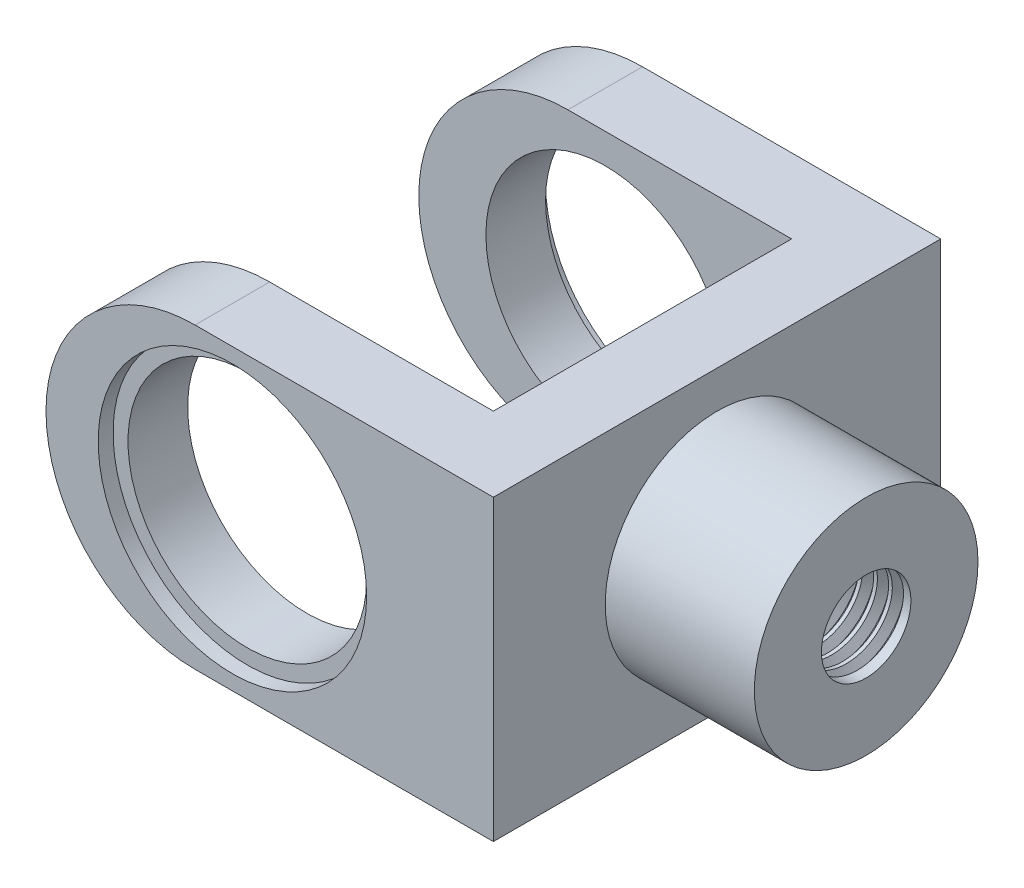
from build123d import *
from build123d.topology import SkipClean

# Parameters (mm, degrees)
IZIM1_R                     = 4
Y_KSEKLIK_EKSTR_ZYON1_DEPTH = 30
IZIM2_W                     = 20
IZIM2_H                     = 20
KES_EKSTR_ZYON1_DEPTH       = 51
IZIM3_W                     = 30
IZIM3_H                     = 20
Y_KSEKLIK_EKSTR_ZYON2_DEPTH = 5
IZIM4_R                     = 7.5
Y_KSEKLIK_EKSTR_ZYON3_DEPTH = 10
IZIM7_R                     = 3
KES_EKSTR_ZYON2_DEPTH       = 10
SKETCH1_R                   = 8
CUT_EXTRUDE1_DEPTH          = 33
SKETCH2_R                   = 9
CUT_EXTRUDE2_DEPTH          = 1
SKETCH3_R                   = 9
CUT_EXTRUDE3_DEPTH          = 1
THREAD1_PITCH               = 1


with BuildPart() as part:
    # Çizim1 → Yükseklik-Ekstrüzyon1 (new body)
    with BuildSketch(Plane.XY):
        with BuildLine():
            Line((0, 10), (20, 10))
            Line((20, 10), (20, -10))
            Line((20, -10), (0, -10))
            ThreePointArc((0, -10), (-10, 0), (0, 10))
        make_face()
        with Locations((2.5, 0)):
            Circle(IZIM1_R, mode=Mode.SUBTRACT)
    extrude(amount=Y_KSEKLIK_EKSTR_ZYON1_DEPTH)

    # Çizim2 → Kes-Ekstrüzyon1 (cut)
    with BuildSketch(Plane(origin=(20, 0, 0), x_dir=(0, 0, -1), z_dir=(1, 0, 0))):
        with Locations((-15, 0)):
            Rectangle(IZIM2_W, IZIM2_H)
    extrude(amount=-KES_EKSTR_ZYON1_DEPTH, mode=Mode.SUBTRACT)


with BuildPart() as kes_ekstr_zyon1_piece_1:
    # of the separate pieces the step leaves, piece 1, a body of its own (kes_ekstr_zyon1_pieces)
    add(part.part.solids().sort_by_distance((20, 10, 25))[0])



with BuildPart() as kes_ekstr_zyon1_piece_2:
    # of the separate pieces the step leaves, piece 2, a body of its own (kes_ekstr_zyon1_pieces)
    add(part.part.solids().sort_by_distance((0, 10, 0))[0])


with BuildPart() as kes_ekstr_zyon1_piece_1_1:
    add(kes_ekstr_zyon1_piece_1.part)

    add(kes_ekstr_zyon1_piece_2.part)  # Yükseklik-Ekstrüzyon2 merges Kes-Ekstrüzyon1 piece 2
    # Çizim3 → Yükseklik-Ekstrüzyon2 (add)
    with BuildSketch(Plane(origin=(20, 0, 0), x_dir=(0, 0, -1), z_dir=(1, 0, 0))):
        with Locations((-15, 0)):
            Rectangle(IZIM3_W, IZIM3_H)
    extrude(amount=-Y_KSEKLIK_EKSTR_ZYON2_DEPTH)

    # Çizim4 → Yükseklik-Ekstrüzyon3 (add)
    with BuildSketch(Plane(origin=(20, 0, 0), x_dir=(0, 0, -1), z_dir=(1, 0, 0))):
        with Locations((-15, 0)):
            Circle(IZIM4_R)
    extrude(amount=Y_KSEKLIK_EKSTR_ZYON3_DEPTH)

    # Çizim7 → Kes-Ekstrüzyon2 (cut)
    with BuildSketch(Plane(origin=(30, 0, 0), x_dir=(0, 0, -1), z_dir=(1, 0, 0))):
        with Locations((-15, 0)):
            Circle(IZIM7_R)
    extrude(amount=-KES_EKSTR_ZYON2_DEPTH, mode=Mode.SUBTRACT)

    # Sketch1 → Cut-Extrude1 (cut)
    with BuildSketch(Plane.XY.offset(30)):
        with Locations(Location((2.5, 0, 0), (0, 0, 180))):
            Circle(SKETCH1_R)
    extrude(amount=-CUT_EXTRUDE1_DEPTH, mode=Mode.SUBTRACT)

    # Sketch2 → Cut-Extrude2 (cut)
    with BuildSketch(Plane.XY.offset(30)):
        with Locations((2.5, 0)):
            Circle(SKETCH2_R)
    extrude(amount=-CUT_EXTRUDE2_DEPTH, mode=Mode.SUBTRACT)

    # Sketch3 → Cut-Extrude3 (cut)
    with BuildSketch(Plane(origin=(0, 0, 0), x_dir=(-1, 0, 0), z_dir=(0, 0, -1))):
        with Locations(Location((-2.5, 0, 0), (0, 0, 180))):
            Circle(SKETCH3_R)
    extrude(amount=-CUT_EXTRUDE3_DEPTH, mode=Mode.SUBTRACT)

    # Thread1: the profile of Thread Profile1 profile screwed along a right-hand helix of 10 turns, 8 arcs to a turn; built about Z, then put on its axis
    with SkipClean():  # the faces are left unmerged after this step: merging them gives an invalid solid
        thread1_z = Axis((0, 0, 0), (0, 0, 1))
        thread1_corners = [(2.9997, 0, -0.000173205), (3.541265875, 0, 0.312499999), (3.541265875, 0, 0.437499999), (2.9997, 0, 0.750173202)]
        with BuildLine(mode=Mode.PRIVATE) as thread1_profile:
            Line(thread1_corners[0], thread1_corners[1])
            Line(thread1_corners[1], thread1_corners[2])
            Line(thread1_corners[2], thread1_corners[3])
            Line(thread1_corners[3], thread1_corners[0])
        thread1_cap = Face(thread1_profile.wire())
        thread1_turn_angles = [0, 22.5, 45, 67.5, 90, 112.5, 135, 157.5, 180, 202.5, 225, 247.5, 270, 292.5, 315, 337.5, 360]
        thread1_turn_weights = [1, 0.9238795325112867, 1, 0.9238795325112867, 1, 0.9238795325112867, 1, 0.9238795325112867, 1, 0.9238795325112867, 1, 0.9238795325112867, 1, 0.9238795325112867, 1, 0.9238795325112867, 1]
        thread1_turn_rails = [Edge.make_bspline([Vector(p[0], p[1], 0).rotate(thread1_z, thread1_turn_angles[k]) / thread1_turn_weights[k] + Vector(0, 0, p[2] + THREAD1_PITCH * thread1_turn_angles[k] / 360) for k in range(17)], [0, 0, 0, 1, 1, 2, 2, 3, 3, 4, 4, 5, 5, 6, 6, 7, 7, 8, 8, 8], 2, thread1_turn_weights) for p in thread1_corners]
        thread1_turn_sides = [Face.make_surface_from_curves(thread1_turn_rails[p[0]], thread1_turn_rails[p[1]]) for p in [(0, 1), (1, 2), (2, 3), (3, 0)]]
        thread1 = Plane(origin=(30, 0, 15), x_dir=(0, 0, 1), z_dir=(-1, 0, 0)) * Solid(Shell([*[p.moved(Location((0, 0, THREAD1_PITCH * i))) for i in range(10) for p in thread1_turn_sides], thread1_cap, thread1_cap.rotate(thread1_z, 3600).moved(Location((0, 0, THREAD1_PITCH * 3600 / 360)))]))
        add(thread1, mode=Mode.SUBTRACT)


solid = kes_ekstr_zyon1_piece_1_1.part
